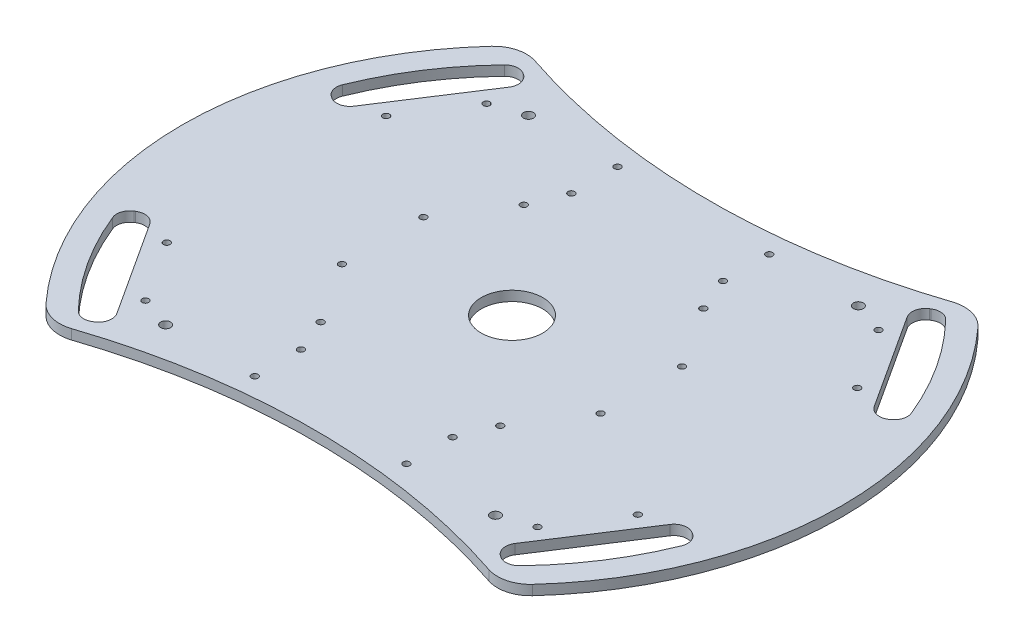
from build123d import *

# Parameters (mm, degrees)
ESBO_O1_R                 = 9.327345029
RESSALTO_EXTRUS_O1_DEPTH  = 3
FILETE1_R                 = 10
ESBO_O2_R                 = 1
CORTE_EXTRUS_O1_DEPTH     = 123.545028697
FILETE3_R                 = 4
FILETE3_OF_ESPELHAR1_R    = 4
ESPELHAR2_OUTLINE_R       = 1
ESPELHAR2_DEPTH           = 3
ESBO_O4_R                 = 1.5
CORTE_EXTRUS_O3_DEPTH     = 123.545028697
ESPELHAR4_COPY_1_SKETCH_R = 1.5
ESPELHAR4_COPY_1_DEPTH    = 123.545028697
ESBO_O5_R                 = 1
CORTE_EXTRUS_O4_DEPTH     = 123.545028697


# Read off the part's stored shape, not the designer's step: Espelhar2
with BuildPart() as part:
    # Esboço1 → Ressalto-extrusão1 (new body)
    with BuildSketch(Plane(origin=(0, 0, 0), x_dir=(1, 0, 0), z_dir=(0, 1, 0))):
        with BuildLine():
            ThreePointArc((69.076751756, -72.307692308), (91.944752911, -39.321271752), (100, 0))
            ThreePointArc((100, 0), (91.944752911, 39.321271752), (69.076751756, 72.307692308))
            ThreePointArc((69.076751756, 72.307692308), (0, 60), (-69.076751756, 72.307692308))
            ThreePointArc((-69.076751756, 72.307692308), (-100, 0), (-69.076751756, -72.307692308))
            ThreePointArc((-69.076751756, -72.307692308), (0, -60), (69.076751756, -72.307692308))
        make_face()
        with Locations(Location((0, 0, 0), (0, 0, 270))):
            Circle(ESBO_O1_R, mode=Mode.SUBTRACT)
    extrude(amount=RESSALTO_EXTRUS_O1_DEPTH)

    # Filete1
    filete1_edges = [part.edges().sort_by_distance(p)[0] for p in [
        (-69.076751756, 1.5, -72.307692308),
        (69.076751756, 1.5, -72.307692308),
        (69.076751756, 1.5, 72.307692308),
        (-69.076751756, 1.5, 72.307692308),
    ]]
    fillet(filete1_edges, radius=FILETE1_R)

    # Esboço2 → Corte-extrusão1 (cut, through all)
    with BuildSketch(Plane(origin=(0, 3, 0), x_dir=(1, 0, 0), z_dir=(0, 1, 0))):
        with BuildLine():
            Line((58.172237404, 62.817121833), (81.047076875, 27.592957979))
            Line((81.047076875, 27.592957979), (87.41930694, 31.731132569))
            ThreePointArc((87.41930694, 31.731132569), (83.247103811, 41.459856573), (77.996361738, 50.651431921))
            ThreePointArc((77.996361738, 50.651431921), (71.735109934, 59.186772195), (64.544467469, 66.955296423))
            Line((64.544467469, 66.955296423), (58.172237404, 62.817121833))
        make_face()
        with Locations(Location((27.220325105, 30.793082034, 0), (0, 0, 270))):
            Circle(ESBO_O2_R)
        with Locations(Location((39.202383876, 12.342329539, 0), (0, 0, 270))):
            Circle(ESBO_O2_R)
        with Locations(Location((59.425274915, 51.707220979, 0), (0, 0, 270))):
            Circle(ESBO_O2_R)
        with Locations(Location((71.407333685, 33.256468484, 0), (0, 0, 270))):
            Circle(ESBO_O2_R)
    corte_extrus_o1 = extrude(amount=-CORTE_EXTRUS_O1_DEPTH, mode=Mode.SUBTRACT)

    # Filete3
    filete3_edges = [part.edges().sort_by_distance(p)[0] for p in [
        (87.41930694, 1.5, -31.731132569),
        (81.047076875, 1.5, -27.592957979),
        (58.172237404, 1.5, -62.817121833),
        (64.544467469, 1.5, -66.955296423),
    ]]
    fillet(filete3_edges, radius=FILETE3_R)

    # Espelhar1: Corte-extrusão1 across plane
    add(corte_extrus_o1.mirror(Plane(origin=(0, 0, 0), x_dir=(0, 0, 1), z_dir=(1, 0, 0))), mode=Mode.SUBTRACT)

    # Filete3 of Espelhar1
    filete3_of_espelhar1_edges = [part.edges().sort_by_distance(p)[0] for p in [
        (-87.41930694, 1.5, -31.731132569),
        (-81.047076875, 1.5, -27.592957979),
        (-58.172237404, 1.5, -62.817121833),
        (-64.544467469, 1.5, -66.955296423),
    ]]
    fillet(filete3_of_espelhar1_edges, radius=FILETE3_OF_ESPELHAR1_R)

    # Espelhar2 outline → Espelhar2 (cut)
    with BuildSketch(Plane(origin=(0, 0, 0), x_dir=(1, 0, 0), z_dir=(0, 1, 0))):
        with BuildLine():
            Line((-61.829947011, -65.192466226), (-61.526919676, -64.995677973))
            ThreePointArc((-61.526919676, -64.995677973), (-59.792885413, -62.472642464), (-60.350793544, -59.462439561))
            Line((-60.350793544, -59.462439561), (-78.868520735, -30.947640251))
            ThreePointArc((-78.868520735, -30.947640251), (-81.391556244, -29.213605988), (-84.401759147, -29.771514119))
            Line((-84.401759147, -29.771514119), (-84.704786482, -29.968302372))
            ThreePointArc((-84.704786482, -29.968302372), (-86.340974216, -32.119768464), (-86.235274402, -34.820646875))
            ThreePointArc((-86.235274402, -34.820646875), (-77.996362819, -50.651430256), (-66.88528981, -64.617010199))
            ThreePointArc((-66.88528981, -64.617010199), (-64.460906593, -65.812118002), (-61.829947011, -65.192466226))
        make_face()
        with BuildLine():
            ThreePointArc((61.829947011, -65.192466226), (64.460906593, -65.812118002), (66.88528981, -64.617010199))
            ThreePointArc((66.88528981, -64.617010199), (77.996362819, -50.651430256), (86.235274402, -34.820646875))
            ThreePointArc((86.235274402, -34.820646875), (86.340974216, -32.119768464), (84.704786482, -29.968302372))
            Line((84.704786482, -29.968302372), (84.401759147, -29.771514119))
            ThreePointArc((84.401759147, -29.771514119), (81.391556244, -29.213605988), (78.868520735, -30.947640251))
            Line((78.868520735, -30.947640251), (60.350793544, -59.462439561))
            ThreePointArc((60.350793544, -59.462439561), (59.792885413, -62.472642464), (61.526919676, -64.995677973))
            Line((61.526919676, -64.995677973), (61.829947011, -65.192466226))
        make_face()
        with Locations((-27.220325105, -30.793082034)):
            Circle(ESPELHAR2_OUTLINE_R)
        with Locations((-39.202383876, -12.342329539)):
            Circle(ESPELHAR2_OUTLINE_R)
        with Locations((-59.425274915, -51.707220979)):
            Circle(ESPELHAR2_OUTLINE_R)
        with Locations((-71.407333685, -33.256468484)):
            Circle(ESPELHAR2_OUTLINE_R)
        with Locations((27.220325105, -30.793082034)):
            Circle(ESPELHAR2_OUTLINE_R)
        with Locations((39.202383876, -12.342329539)):
            Circle(ESPELHAR2_OUTLINE_R)
        with Locations((59.425274915, -51.707220979)):
            Circle(ESPELHAR2_OUTLINE_R)
        with Locations((71.407333685, -33.256468484)):
            Circle(ESPELHAR2_OUTLINE_R)
    extrude(amount=ESPELHAR2_DEPTH, mode=Mode.SUBTRACT)

    # Esboço4 → Corte-extrusão3 (cut, through all)
    with BuildSketch(Plane(origin=(0, 3, 0), x_dir=(1, 0, 0), z_dir=(0, 1, 0))):
        with Locations(Location((-50, 55, 0), (0, 0, 270))):
            Circle(ESBO_O4_R)
    corte_extrus_o3 = extrude(amount=-CORTE_EXTRUS_O3_DEPTH, mode=Mode.SUBTRACT)

    # Espelhar3: Corte-extrusão3 across plane
    add(corte_extrus_o3.mirror(Plane(origin=(0, 0, 0), x_dir=(0, 0, 1), z_dir=(1, 0, 0))), mode=Mode.SUBTRACT)

    # Espelhar4: Corte-extrusão3 across plane
    add(corte_extrus_o3.mirror(Plane.XY), mode=Mode.SUBTRACT)

    # Espelhar4 copy 1 sketch → Espelhar4 copy 1 (cut, through all)
    with BuildSketch(Plane(origin=(0, 3, 0), x_dir=(-1, 0, 0), z_dir=(0, 1, 0))):
        with Locations(Location((-50, 55, 0), (0, 0, 270))):
            Circle(ESPELHAR4_COPY_1_SKETCH_R)
    extrude(amount=-ESPELHAR4_COPY_1_DEPTH, mode=Mode.SUBTRACT)

    # Esboço5 → Corte-extrusão4 (cut, through all)
    with BuildSketch(Plane(origin=(0, 3, 0), x_dir=(1, 0, 0), z_dir=(0, 1, 0))):
        with Locations(Location((23, 55, 0), (0, 0, 270))):
            Circle(ESBO_O5_R)
        with Locations(Location((23, 41, 0), (0, 0, 270))):
            Circle(ESBO_O5_R)
        with Locations(Location((-23, 55, 0), (0, 0, 90))):
            Circle(ESBO_O5_R)
        with Locations(Location((-23, 41, 0), (0, 0, 90))):
            Circle(ESBO_O5_R)
        with Locations(Location((-23, -41, 0), (0, 0, 270))):
            Circle(ESBO_O5_R)
        with Locations(Location((-23, -55, 0), (0, 0, 270))):
            Circle(ESBO_O5_R)
        with Locations(Location((23, -55, 0), (0, 0, 90))):
            Circle(ESBO_O5_R)
        with Locations(Location((23, -41, 0), (0, 0, 90))):
            Circle(ESBO_O5_R)
    extrude(amount=-CORTE_EXTRUS_O4_DEPTH, mode=Mode.SUBTRACT)


solid = part.part
